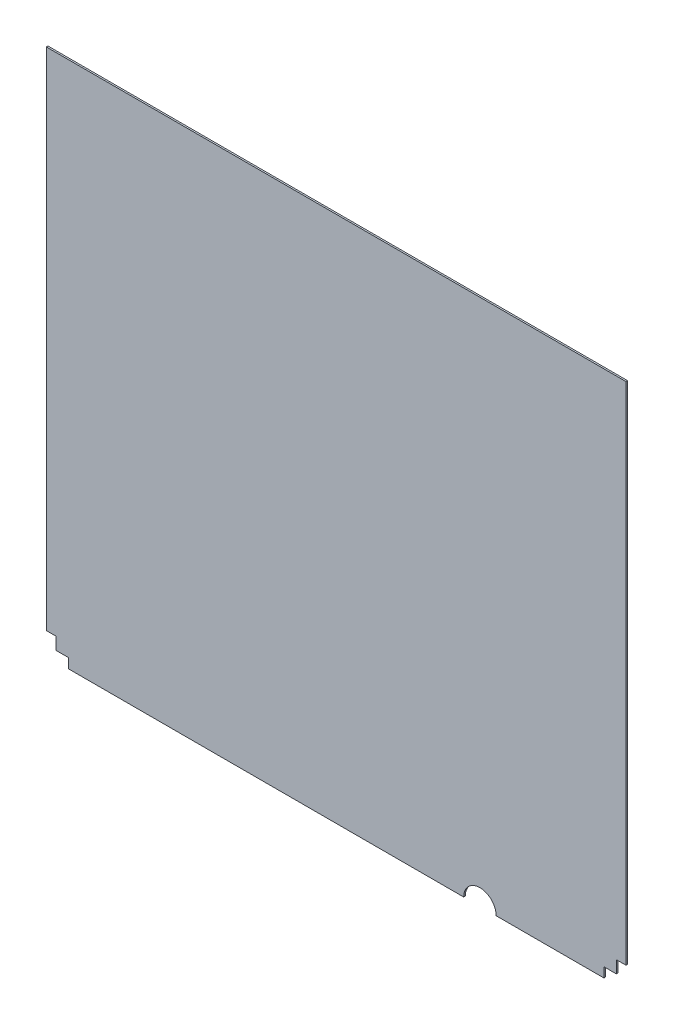
from build123d import *

# Parameters (mm, degrees)
BOSS_EXTRUDE1_DEPTH = 2.54


with BuildPart() as part:
    # Sketch1 → Boss-Extrude1 (new body)
    with BuildSketch(Plane.XY):
        with BuildLine():
            Line((0, 825.5), (0, 34.544))
            Line((0, 34.544), (15.24, 34.544))
            Line((15.24, 34.544), (15.24, 15.24))
            Line((15.24, 15.24), (34.544, 15.24))
            Line((34.544, 15.24), (34.544, 0))
            Line((34.544, 0), (653.00098, 0))
            ThreePointArc((653.00098, 0), (678.40098, 25.4), (703.80098, 0))
            Line((703.80098, 0), (872.45698, 0))
            Line((872.45698, 0), (872.45698, 15.24))
            Line((872.45698, 15.24), (891.76098, 15.24))
            Line((891.76098, 15.24), (891.76098, 34.544))
            Line((891.76098, 34.544), (907.00098, 34.544))
            Line((907.00098, 34.544), (907.00098, 825.5))
            Line((907.00098, 825.5), (0, 825.5))
        make_face()
    extrude(amount=BOSS_EXTRUDE1_DEPTH)


solid = part.part
